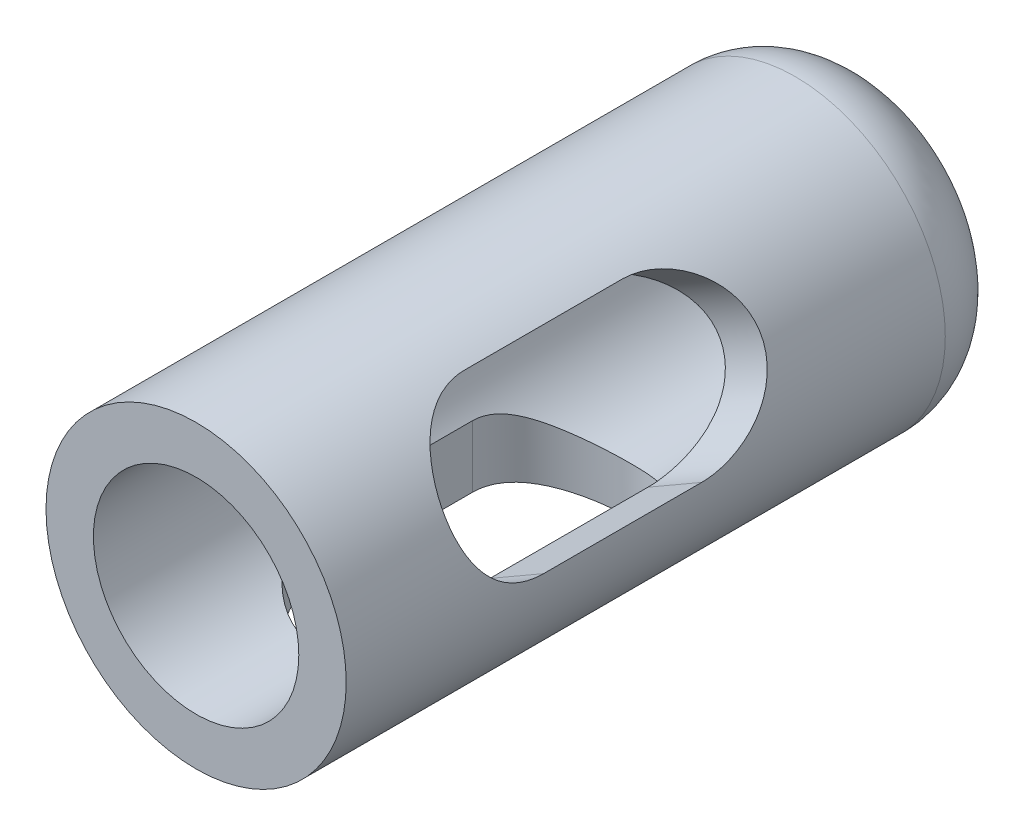
from build123d import *

# Parameters (mm, degrees)
SKETCH_1_R               = 3.8
SKETCH_1_R_2             = 2.6
EXTRUDE_1_DEPTH          = 17
CUT_EXTRUDE_1_DEPTH      = 17
PATTERN_CIRCULAR_1_COUNT = 2
PATTERN_CIRCULAR_1_ANGLE = 120
FILLET_1_R               = 2


with BuildPart() as part:
    # 스케치1 → 보스-돌출1 (new body)
    with BuildSketch(Plane.XY):
        Circle(SKETCH_1_R)
        Circle(SKETCH_1_R_2, mode=Mode.SUBTRACT)
    extrude(amount=EXTRUDE_1_DEPTH)

    # 스케치2 → 컷-돌출1 (cut)
    with BuildSketch(Plane(origin=(0, 0, 0), x_dir=(1, 0, 0), z_dir=(0, 1, 0))):
        with BuildLine():
            Line((-2, -8), (-2, -12))
            ThreePointArc((-2, -12), (0, -14), (2, -12))
            Line((2, -12), (2, -8))
            ThreePointArc((2, -8), (0, -6), (-2, -8))
        make_face()
    cut_extrude_1 = extrude(amount=-CUT_EXTRUDE_1_DEPTH, mode=Mode.SUBTRACT)

    # 원형 패턴1: 컷-돌출1 ×2 about axis
    pattern_circular_1_axis = Axis((0, 0, 0), (0, 0, 1))
    for i in range(1, PATTERN_CIRCULAR_1_COUNT):
        add(cut_extrude_1.rotate(pattern_circular_1_axis, i * PATTERN_CIRCULAR_1_ANGLE / (PATTERN_CIRCULAR_1_COUNT - 1)), mode=Mode.SUBTRACT)

    # 필렛1
    # the kernel refuses this fillet: 2 mm, written as the material it takes off along each edge
    with BuildSketch(Plane(origin=(0, 0, 0), x_dir=(1, 0, 0), z_dir=(0, -1, 0))) as fillet_1_piece_1:
        with BuildLine():
            CenterArc((1.8, 1.833030278), FILLET_1_R, 293.578178478, 66.421821522)
            Line((2.6, 0), (2.616, -0.036660606))
            ThreePointArc((2.616, -0.036660606), (3.2, -0.04), (3.8, -0.04))
            Line((3.8, -0.04), (3.84, 0))
            Line((3.84, 0), (3.84, 1.833030278))
            Line((3.84, 1.833030278), (3.8, 1.833030278))
        make_face()
    revolve(axis=Axis((0, 0, 0), (0, 0, 1)), mode=Mode.SUBTRACT)


solid = part.part
